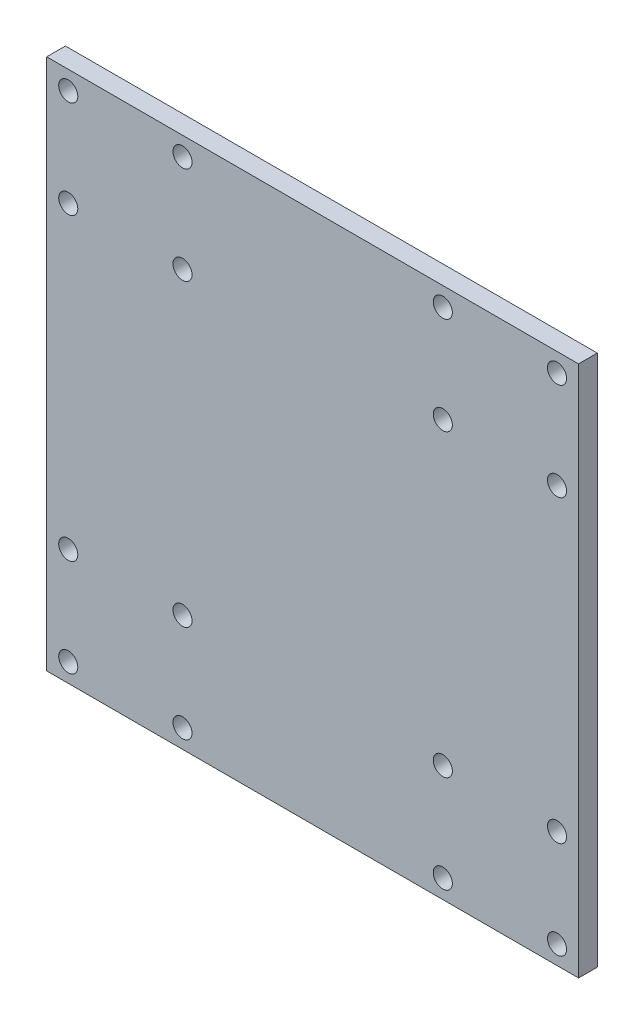
from build123d import *

# Parameters (mm, degrees)
SKETCH1_W           = 142
SKETCH1_H           = 142
BOSS_EXTRUDE1_DEPTH = 2.5
SKETCH2_R           = 2.55
CUT_EXTRUDE1_DEPTH  = 101.533576481


with BuildPart() as part:
    # Sketch1 → Boss-Extrude1 (new, symmetric)
    with BuildSketch(Plane.XY):
        Rectangle(SKETCH1_W, SKETCH1_H)
    extrude(amount=BOSS_EXTRUDE1_DEPTH, both=True)

    # Sketch2 → Cut-Extrude1 (cut, through all)
    with BuildSketch(Plane.XY.offset(2.5)):
        with Locations((-65.25, 66)):
            Circle(SKETCH2_R)
        with Locations((-34.75, 66)):
            Circle(SKETCH2_R)
        with Locations((-34.75, 40)):
            Circle(SKETCH2_R)
        with Locations((-65.25, 40)):
            Circle(SKETCH2_R)
        with Locations((65.25, 66)):
            Circle(SKETCH2_R)
        with Locations((65.25, 40)):
            Circle(SKETCH2_R)
        with Locations((34.75, 40)):
            Circle(SKETCH2_R)
        with Locations((34.75, 66)):
            Circle(SKETCH2_R)
        with Locations((-65.25, -40)):
            Circle(SKETCH2_R)
        with Locations((-34.75, -40)):
            Circle(SKETCH2_R)
        with Locations((-34.75, -66)):
            Circle(SKETCH2_R)
        with Locations((-65.25, -66)):
            Circle(SKETCH2_R)
        with Locations((34.75, -40)):
            Circle(SKETCH2_R)
        with Locations((65.25, -40)):
            Circle(SKETCH2_R)
        with Locations((65.25, -66)):
            Circle(SKETCH2_R)
        with Locations((34.75, -66)):
            Circle(SKETCH2_R)
    extrude(amount=-CUT_EXTRUDE1_DEPTH, mode=Mode.SUBTRACT)


solid = part.part
